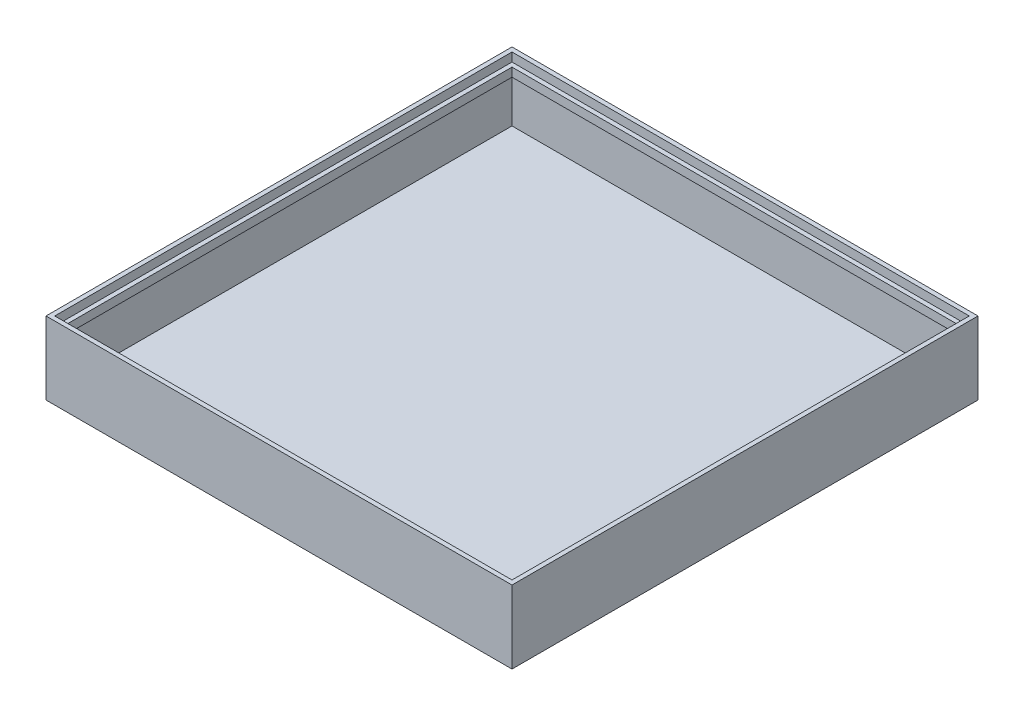
from build123d import *

# Parameters (mm, degrees)
SKETCH2_W          = 160
SKETCH2_H          = 160
OUTER_BLOCK_DEPTH  = 25
SKETCH12_W         = 157
SKETCH12_H         = 157
CUT_EXTRUDE1_DEPTH = 3
SKETCH14_W         = 157
SKETCH14_H         = 157
CUT_EXTRUDE4_DEPTH = 16
SKETCH15_W         = 154
SKETCH15_H         = 154
CUT_EXTRUDE6_DEPTH = 5


with BuildPart() as part:
    # Sketch2 → Outer Block (new body)
    with BuildSketch(Plane(origin=(0, 0, 0), x_dir=(1, 0, 0), z_dir=(0, 1, 0))):
        Rectangle(SKETCH2_W, SKETCH2_H)
    extrude(amount=OUTER_BLOCK_DEPTH)

    # Sketch12 → Cut-Extrude1 (cut)
    with BuildSketch(Plane(origin=(0, 25, 0), x_dir=(1, 0, 0), z_dir=(0, 1, 0))):
        Rectangle(SKETCH12_W, SKETCH12_H)
    extrude(amount=-CUT_EXTRUDE1_DEPTH, mode=Mode.SUBTRACT)

    # Sketch14 → Cut-Extrude4 (cut)
    with BuildSketch(Plane(origin=(0, 3, 0), x_dir=(-1, 0, 0), z_dir=(0, -1, 0))):
        Rectangle(SKETCH14_W, SKETCH14_H)
    extrude(amount=-CUT_EXTRUDE4_DEPTH, mode=Mode.SUBTRACT)

    # Sketch15 → Cut-Extrude6 (cut)
    with BuildSketch(Plane(origin=(0, 22, 0), x_dir=(1, 0, 0), z_dir=(0, 1, 0))):
        Rectangle(SKETCH15_W, SKETCH15_H)
    extrude(amount=-CUT_EXTRUDE6_DEPTH, mode=Mode.SUBTRACT)


solid = part.part
